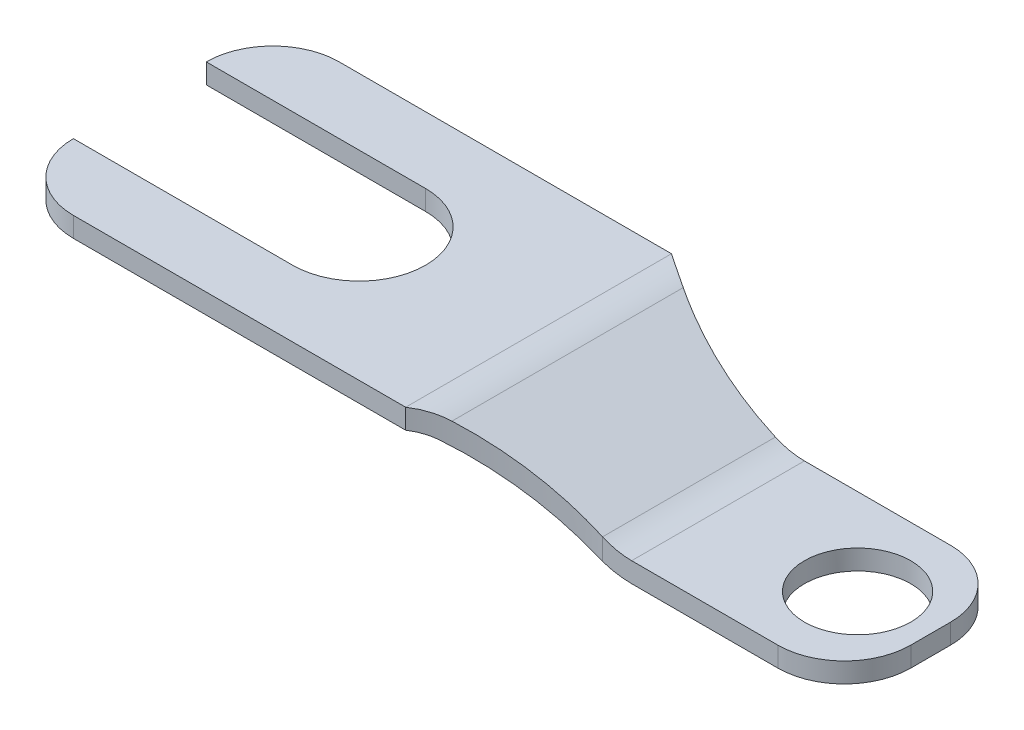
from build123d import *

# Parameters (mm, degrees)
SURFACE_EXTRUDE1_1_BACK  = 1
SURFACE_EXTRUDE1_1_DEPTH = 2
THICKEN1_T2              = 0.15
CUT_EXTRUDE2_DEPTH       = 7.054130821
CUT_EXTRUDE2_DEPTH_BACK  = 7.054130821
SKETCH3_R                = 0.4
FILLET1_R                = 0.5


with BuildPart() as body_1:
    # Surface-Extrude1: a surface, the sketch's curves swept straight by 2 mm
    with BuildLine(Plane.XY.offset(-SURFACE_EXTRUDE1_1_BACK), mode=Mode.PRIVATE) as surface_extrude1_1_path:
        Line((0, 0), (3, 0))
        ThreePointArc((3, 0), (3.111597724, -0.011740696), (3.218308792, -0.046448679))
        Line((3.218308792, -0.046448679), (4.131691208, -0.453551321))
        ThreePointArc((4.131691208, -0.453551321), (4.238402276, -0.488259304), (4.35, -0.5))
        Line((4.35, -0.5), (5.95, -0.5))
    surface_extrude1_1 = Shell.extrude(surface_extrude1_1_path.wire(), (0 * SURFACE_EXTRUDE1_1_DEPTH, 0 * SURFACE_EXTRUDE1_1_DEPTH, 1 * SURFACE_EXTRUDE1_1_DEPTH))
    add(Solid.thicken(surface_extrude1_1, -THICKEN1_T2))

    # Sketch3 → Cut-Extrude2 (cut, two sides: drawn at the far end of the back side and taken through both)
    with BuildSketch(Plane(origin=(0, -0.5, 0), x_dir=(1, 0, 0), z_dir=(0, 1, 0)).offset(-CUT_EXTRUDE2_DEPTH_BACK)):
        with Locations(Location((5.4, 0, 0), (0, 0, 270))):
            Circle(SKETCH3_R)
        with BuildLine():
            Line((1.65, 0.5), (0, 0.5))
            Line((0, 0.5), (0, -0.5))
            Line((0, -0.5), (1.65, -0.5))
            ThreePointArc((1.65, -0.5), (2.15, 0), (1.65, 0.5))
        make_face()
        with BuildLine():
            Line((4.130265456, 0.65), (5.95, 0.65))
            Line((5.95, 0.65), (5.95, 1))
            Line((5.95, 1), (3, 1))
            ThreePointArc((3, 1), (3.538657477, 0.739502683), (4.130265456, 0.65))
        make_face()
        with BuildLine():
            Line((4.130265456, -0.65), (5.95, -0.65))
            Line((5.95, -0.65), (5.95, -1))
            Line((5.95, -1), (3, -1))
            ThreePointArc((3, -1), (3.538657477, -0.739502683), (4.130265456, -0.65))
        make_face()
    extrude(amount=CUT_EXTRUDE2_DEPTH + CUT_EXTRUDE2_DEPTH_BACK, mode=Mode.SUBTRACT)

    # Fillet1
    fillet1_edges = [body_1.edges().sort_by_distance(p)[0] for p in [
        (0, -0.075, 1),
        (0, -0.075, -1),
        (5.95, -0.575, -0.65),
        (5.95, -0.575, 0.65),
    ]]
    fillet(fillet1_edges, radius=FILLET1_R - 0.0001)  # a hair under: the kernel refuses the full size


solid = body_1.part
